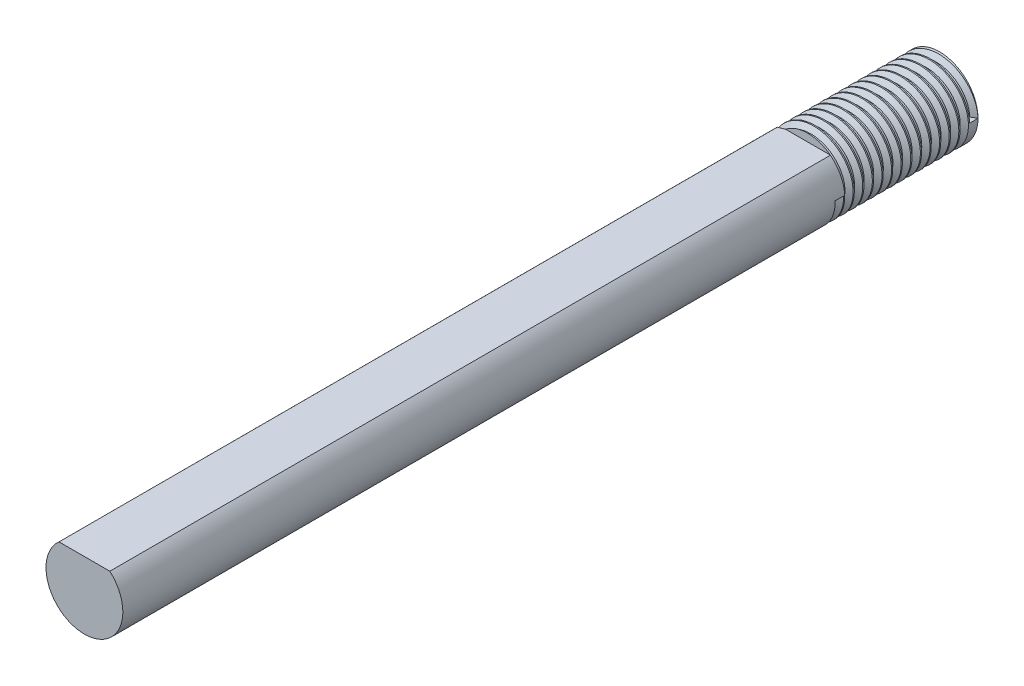
from build123d import *

# Parameters (mm, degrees)
SKETCH1_R           = 4
BOSS_EXTRUDE1_DEPTH = 89
CUT_EXTRUDE1_START  = 3
SKETCH3_W           = 6
SKETCH3_H           = 75
CUT_EXTRUDE1_DEPTH  = 87.179594078
THREAD1_PITCH       = 1


with BuildPart() as part:
    # Sketch1 → Boss-Extrude1 (new body)
    with BuildSketch(Plane.XY):
        Circle(SKETCH1_R)
    extrude(amount=BOSS_EXTRUDE1_DEPTH)

    # Sketch3 → Cut-Extrude1 (cut, through all)
    with BuildSketch(Plane(origin=(0, 0, 0), x_dir=(1, 0, 0), z_dir=(0, 1, 0)).offset(CUT_EXTRUDE1_START)):
        with Locations((0, -51.5)):
            Rectangle(SKETCH3_W, SKETCH3_H)
    extrude(amount=CUT_EXTRUDE1_DEPTH, mode=Mode.SUBTRACT)

    # Thread1: the profile of Thread Profile1 profile screwed along a right-hand helix of 14 turns, 8 arcs to a turn; built about Z, then put on its axis
    thread1_z = Axis((0, 0, 0), (0, 0, 1))
    thread1_corners = [(4.0003, 0, -0.000173205), (4.0003, 0, 0.875173202), (3.458734125, 0, 0.562499999), (3.458734125, 0, 0.312499999)]
    with BuildLine(mode=Mode.PRIVATE) as thread1_profile:
        Line(thread1_corners[0], thread1_corners[1])
        Line(thread1_corners[1], thread1_corners[2])
        Line(thread1_corners[2], thread1_corners[3])
        Line(thread1_corners[3], thread1_corners[0])
    thread1_cap = Face(thread1_profile.wire())
    thread1_turn_angles = [0, 22.5, 45, 67.5, 90, 112.5, 135, 157.5, 180, 202.5, 225, 247.5, 270, 292.5, 315, 337.5, 360]
    thread1_turn_weights = [1, 0.9238795325112867, 1, 0.9238795325112867, 1, 0.9238795325112867, 1, 0.9238795325112867, 1, 0.9238795325112867, 1, 0.9238795325112867, 1, 0.9238795325112867, 1, 0.9238795325112867, 1]
    thread1_turn_rails = [Edge.make_bspline([Vector(p[0], p[1], 0).rotate(thread1_z, thread1_turn_angles[k]) / thread1_turn_weights[k] + Vector(0, 0, p[2] + THREAD1_PITCH * thread1_turn_angles[k] / 360) for k in range(17)], [0, 0, 0, 1, 1, 2, 2, 3, 3, 4, 4, 5, 5, 6, 6, 7, 7, 8, 8, 8], 2, thread1_turn_weights) for p in thread1_corners]
    thread1_turn_sides = [Face.make_surface_from_curves(thread1_turn_rails[p[0]], thread1_turn_rails[p[1]]) for p in [(0, 1), (1, 2), (2, 3), (3, 0)]]
    thread1 = Plane(origin=(0, 0, 0), x_dir=(1, 0, 0), z_dir=(0, 0, 1)) * Solid(Shell([*[p.moved(Location((0, 0, THREAD1_PITCH * i))) for i in range(14) for p in thread1_turn_sides], thread1_cap, thread1_cap.rotate(thread1_z, 5040).moved(Location((0, 0, THREAD1_PITCH * 5040 / 360)))]))
    add(thread1, mode=Mode.SUBTRACT)


solid = part.part
